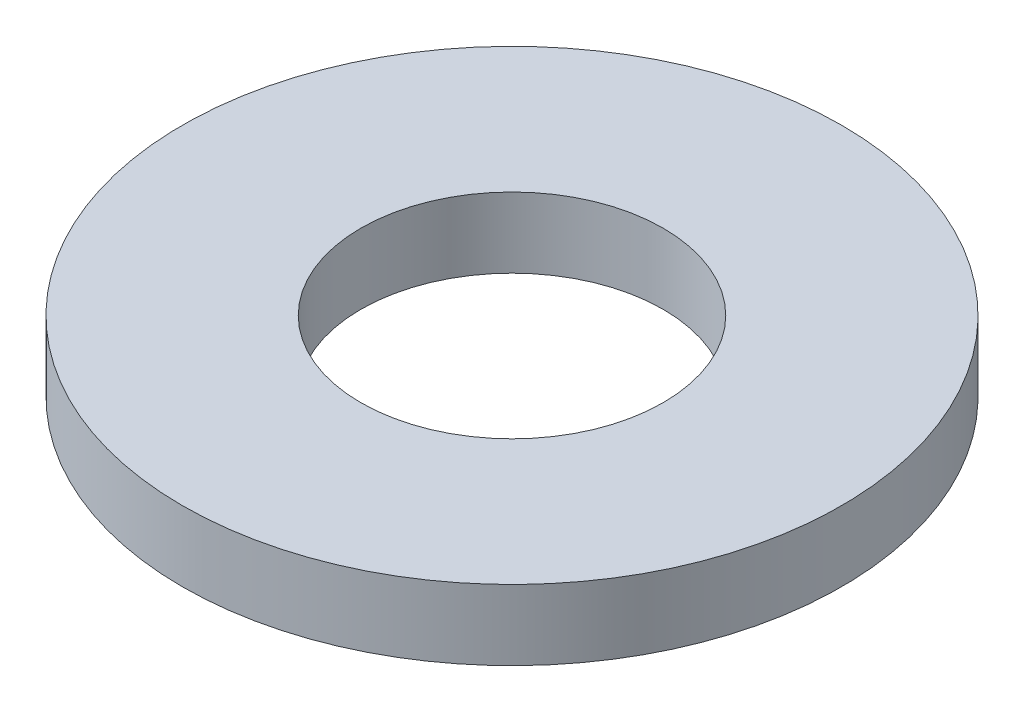
from build123d import *

# Parameters (mm, degrees)
SKETCH1_R           = 4.7625
BOSS_EXTRUDE1_DEPTH = 1.016
SKETCH5_R           = 2.1844
CUT_EXTRUDE1_DEPTH  = 7.811392552


with BuildPart() as part:
    # Sketch1 → Boss-Extrude1 (new body)
    with BuildSketch(Plane(origin=(0, 0, 0), x_dir=(1, 0, 0), z_dir=(0, 1, 0))):
        Circle(SKETCH1_R)
    extrude(amount=BOSS_EXTRUDE1_DEPTH)

    # Sketch5 → Cut-Extrude1 (cut, through all)
    with BuildSketch(Plane(origin=(0, 1.016, 0), x_dir=(-1, 0, 0), z_dir=(0, 1, 0))):
        Circle(SKETCH5_R)
    extrude(amount=-CUT_EXTRUDE1_DEPTH, mode=Mode.SUBTRACT)


solid = part.part
